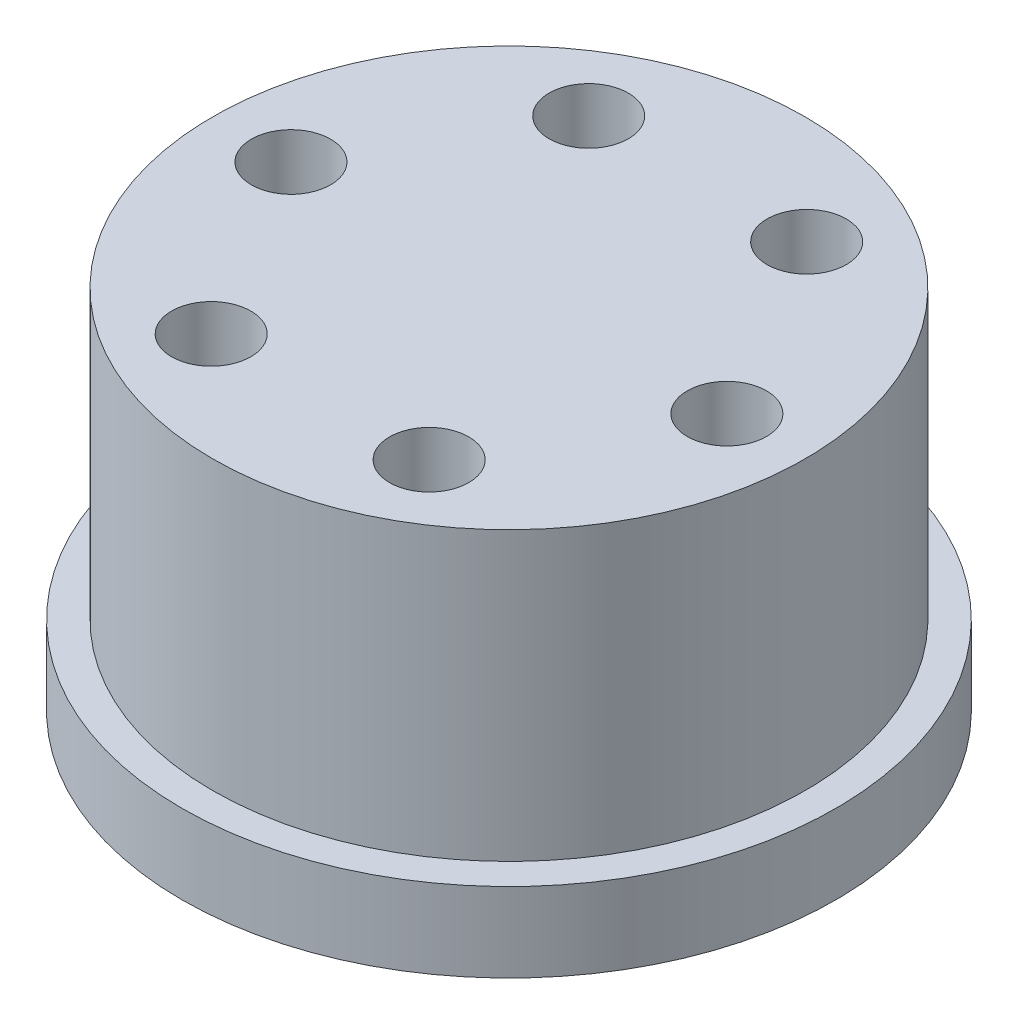
from build123d import *

# Parameters (mm, degrees)
SKETCH1_R           = 16.5
SKETCH1_R_2         = 1.75
BOSS_EXTRUDE1_DEPTH = 4
SKETCH2_R           = 14.95
BOSS_EXTRUDE2_DEPTH = 14.5
SKETCH5_R           = 2
CUT_EXTRUDE3_DEPTH  = 6.5
SKETCH6_R           = 7.6
CUT_EXTRUDE4_DEPTH  = 5


with BuildPart() as part:
    # Sketch1 → Boss-Extrude1 (new body)
    with BuildSketch(Plane(origin=(0, 0, 0), x_dir=(1, 0, 0), z_dir=(0, 1, 0))):
        Circle(SKETCH1_R)
        with Locations((0, 12.5)):
            Circle(SKETCH1_R_2, mode=Mode.SUBTRACT)
        with Locations((10.825317547, 6.25)):
            Circle(SKETCH1_R_2, mode=Mode.SUBTRACT)
        with Locations((10.825317547, -6.25)):
            Circle(SKETCH1_R_2, mode=Mode.SUBTRACT)
        with Locations((0, -12.5)):
            Circle(SKETCH1_R_2, mode=Mode.SUBTRACT)
        with Locations((-10.825317547, -6.25)):
            Circle(SKETCH1_R_2, mode=Mode.SUBTRACT)
        with Locations((-10.825317547, 6.25)):
            Circle(SKETCH1_R_2, mode=Mode.SUBTRACT)
    extrude(amount=BOSS_EXTRUDE1_DEPTH)

    # Sketch2 → Boss-Extrude2 (add)
    with BuildSketch(Plane(origin=(0, 4, 0), x_dir=(1, 0, 0), z_dir=(0, 1, 0))):
        Circle(SKETCH2_R)
    extrude(amount=BOSS_EXTRUDE2_DEPTH)

    # Sketch5 → Cut-Extrude3 (cut)
    with BuildSketch(Plane(origin=(0, 18.5, 0), x_dir=(1, 0, 0), z_dir=(0, 1, 0))):
        with Locations((-11, 0)):
            Circle(SKETCH5_R)
        with Locations((-5.5, 9.526279442)):
            Circle(SKETCH5_R)
        with Locations((5.5, 9.526279442)):
            Circle(SKETCH5_R)
        with Locations((11, 0)):
            Circle(SKETCH5_R)
        with Locations((5.5, -9.526279442)):
            Circle(SKETCH5_R)
        with Locations((-5.5, -9.526279442)):
            Circle(SKETCH5_R)
    extrude(amount=-CUT_EXTRUDE3_DEPTH, mode=Mode.SUBTRACT)

    # Sketch6 → Cut-Extrude4 (cut)
    with BuildSketch(Plane.XZ):
        Circle(SKETCH6_R)
    extrude(amount=-CUT_EXTRUDE4_DEPTH, mode=Mode.SUBTRACT)


solid = part.part
